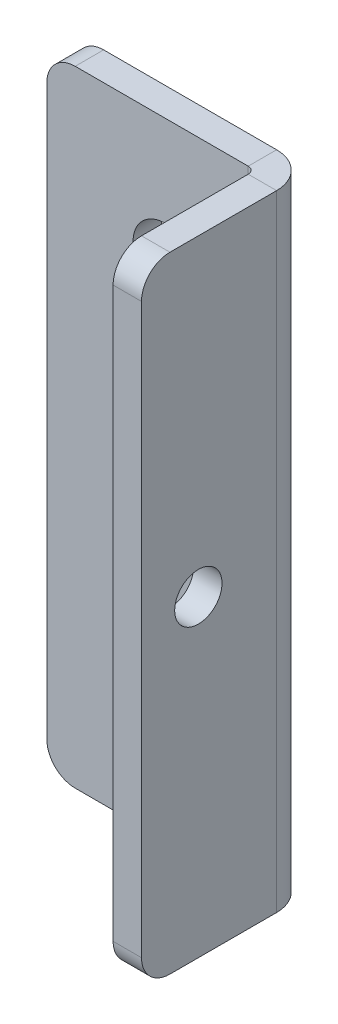
from build123d import *

# Parameters (mm, degrees)
SKETCH_1_W                       = 25
SKETCH_1_H                       = 66
SM_BASE_FLANGE_1_DEPTH           = 3
SM_EDGE_FLANGE_1_STRIP_W         = 13.4732
SM_EDGE_FLANGE_1_STRIP_H         = 3
SM_EDGE_FLANGE_1_STRIP_CUT_DEPTH = 66
SM_EDGE_FLANGE_1_DEPTH           = 66
HOLE_WIZARD_M8_1_D               = 6.8
HOLE_WIZARD_M6_2_D               = 5
OTHER_START                      = 9.5
OTHER_1_DEPTH                    = 3
OTHER_START_2                    = -3
OTHER_1_2_DEPTH                  = 3


# Read off the part's stored shape, not the designer's step: 断开-边角1
# Sheet-metal steps are written as plain solids
with BuildPart() as part:
    # Sketch 1 → 基体-法兰1 (new body)
    with BuildSketch(Plane.XY):
        Rectangle(SKETCH_1_W, SKETCH_1_H)
    extrude(amount=-SM_BASE_FLANGE_1_DEPTH)

    # 边线-法兰1 strip (across the edge) → 边线-法兰1 strip cut (cut)
    with BuildSketch(Plane(origin=(12.5, -33, 0), x_dir=(-1, 0, 0), z_dir=(0, 1, 0))):
        with Locations((-3, -1.5)):
            Rectangle(SM_EDGE_FLANGE_1_STRIP_W, SM_EDGE_FLANGE_1_STRIP_H)
    extrude(amount=SM_EDGE_FLANGE_1_STRIP_CUT_DEPTH, mode=Mode.SUBTRACT)

    # 边线-法兰1 section (across the edge) → 边线-法兰1 (add)
    with BuildSketch(Plane(origin=(12.5, -33, 0), x_dir=(-1, 0, 0), z_dir=(0, 1, 0))):
        with BuildLine():
            Line((0, 0.7366), (0, 15))
            Line((0, 15), (3, 15))
            Line((3, 15), (3, 0.7366))
            ThreePointArc((3, 0.7366), (3.215745145, 0.215745145), (3.7366, 0))
            Line((3.7366, 0), (3.7366, -3))
            ThreePointArc((3.7366, -3), (1.094424801, -1.905575199), (0, 0.7366))
        make_face()
    extrude(amount=SM_EDGE_FLANGE_1_DEPTH)

    # M8 螺纹孔1 (through all)
    with Locations(Plane.XY):
        with Locations((0, -20), (0, 20)):
            Hole(HOLE_WIZARD_M8_1_D / 2)

    # M6 螺纹孔2 (through all)
    with Locations(Plane.ZY.offset(-9.5)):
        with Locations((9, 0)):
            Hole(HOLE_WIZARD_M6_2_D / 2)

    # Other 1 outline → Other 1 (cut)
    with BuildSketch(Plane.YZ.offset(OTHER_START)):
        with BuildLine():
            Line((-33, 15), (-33, 12))
            ThreePointArc((-33, 12), (-32.121320344, 14.121320344), (-30, 15))
            Line((-30, 15), (-33, 15))
        make_face()
        with BuildLine():
            Line((33, 15), (30, 15))
            ThreePointArc((30, 15), (32.121320344, 14.121320344), (33, 12))
            Line((33, 12), (33, 15))
        make_face()
    extrude(amount=OTHER_1_DEPTH, mode=Mode.SUBTRACT)

    # Other 1 2 outline → Other 1 2 (cut)
    with BuildSketch(Plane.XY.offset(OTHER_START_2)):
        with BuildLine():
            Line((-12.5, 33), (-12.5, 30))
            ThreePointArc((-12.5, 30), (-11.621320344, 32.121320344), (-9.5, 33))
            Line((-9.5, 33), (-12.5, 33))
        make_face()
        with BuildLine():
            ThreePointArc((-9.5, -33), (-11.621320344, -32.121320344), (-12.5, -30))
            Line((-12.5, -30), (-12.5, -33))
            Line((-12.5, -33), (-9.5, -33))
        make_face()
    extrude(amount=OTHER_1_2_DEPTH, mode=Mode.SUBTRACT)


solid = part.part
